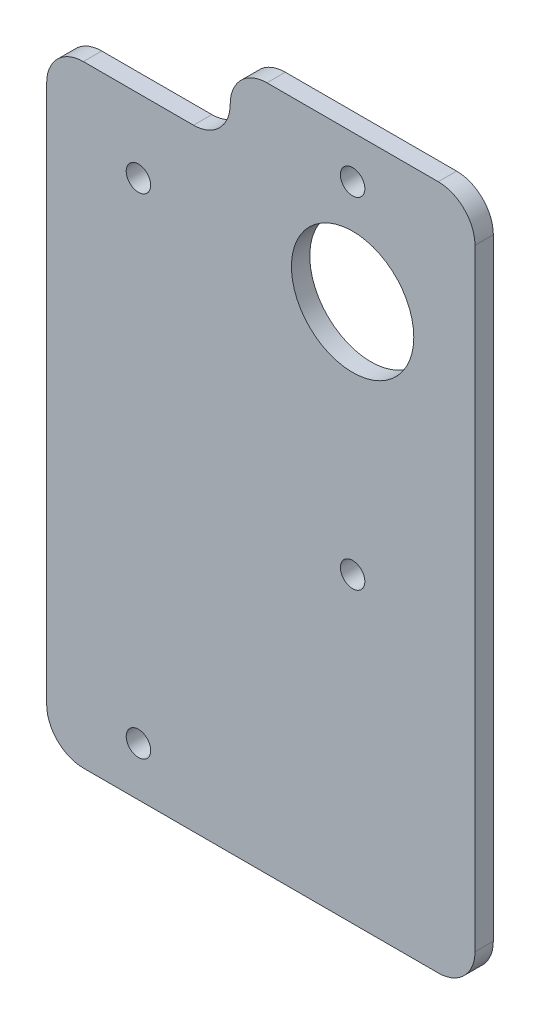
from build123d import *

# Parameters (mm, degrees)
SKETCH_1_R          = 1
SKETCH_1_R_2        = 5
EXTRUDE_1_DEPTH     = 1.5
SKETCH_3_R          = 1
CUT_EXTRUDE_1_DEPTH = 10
FILLET_1_R          = 3


with BuildPart() as part:
    # 草图1 → 凸台-拉伸1 (new body)
    with BuildSketch(Plane.XY):
        Polygon((7.5, 22.5), (-7.5, 22.5), (-7.5, -27.5), (7.5, -27.5), (27.5, -27.5), (27.5, 2.5), (27.5, 14.5), (27.5, 22.5), (27.5, 28.5), (7.5, 28.5), align=None)
        with Locations((0, -23.5)):
            Circle(SKETCH_1_R, mode=Mode.SUBTRACT)
        with Locations((0, 16.5)):
            Circle(SKETCH_1_R, mode=Mode.SUBTRACT)
        with Locations((17.5, 16.5)):
            Circle(SKETCH_1_R_2, mode=Mode.SUBTRACT)
    extrude(amount=EXTRUDE_1_DEPTH)

    # 草图3 → 切除-拉伸1 (cut)
    with BuildSketch(Plane.XY.offset(1.5)):
        with Locations((17.5, -2.8)):
            Circle(SKETCH_3_R)
        with Locations((17.5, 25)):
            Circle(SKETCH_3_R)
    extrude(amount=-CUT_EXTRUDE_1_DEPTH, mode=Mode.SUBTRACT)

    # 圆角1
    fillet_1_edges = [part.edges().sort_by_distance(p)[0] for p in [
        (7.5, 22.5, 0.75),
        (7.5, 28.5, 0.75),
        (-7.5, 22.5, 0.75),
        (27.5, 28.5, 0.75),
        (-7.5, -27.5, 0.75),
        (27.5, -27.5, 0.75),
    ]]
    fillet(fillet_1_edges, radius=FILLET_1_R - 0.0001)  # a hair under: the kernel refuses the full size


solid = part.part
